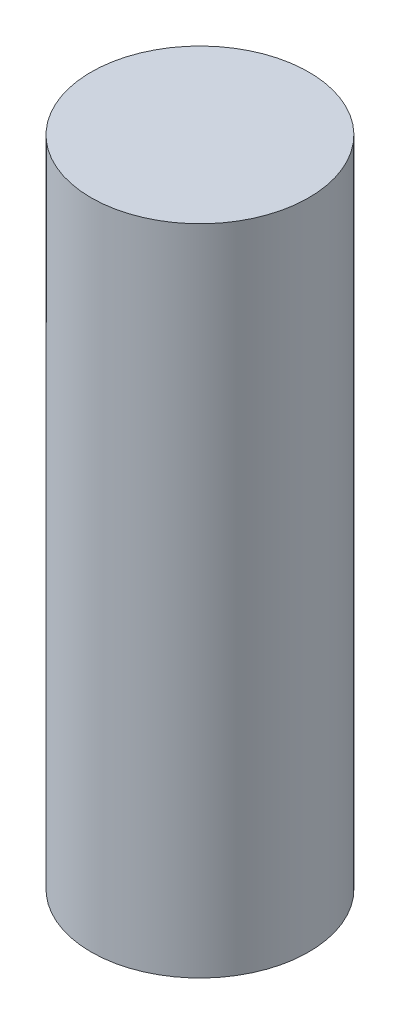
from build123d import *

# Parameters (mm, degrees)
MAIN_PARACHUTE_BAG_PROFILE_R  = 63.5
MAIN_PARACHUTE_BAG_BODY_DEPTH = 381


with BuildPart() as part:
    # Main Parachute Bag Profile → Main Parachute Bag Body (new body)
    with BuildSketch(Plane(origin=(0, 0, 0), x_dir=(1, 0, 0), z_dir=(0, 1, 0))):
        Circle(MAIN_PARACHUTE_BAG_PROFILE_R)
    extrude(amount=MAIN_PARACHUTE_BAG_BODY_DEPTH)


solid = part.part
